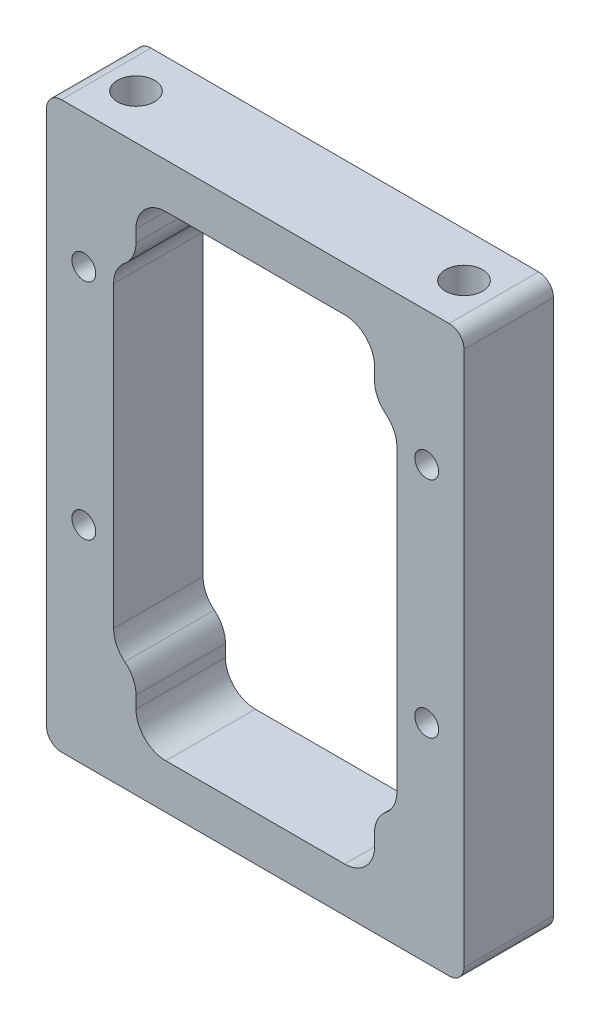
from build123d import *
from OCP.BRepFilletAPI import BRepFilletAPI_MakeFillet

# Parameters (mm, degrees)
SKETCH_1_W                  = 28
SKETCH_1_H                  = 37.9
EXTRUDE_1_DEPTH             = 3
HOLE_WIZARD_M3_1_AT_2_COUNT = 2
HOLE_WIZARD_M3_1_AT_2_PITCH = 22
HOLE_WIZARD_M2_1_D          = 1.6
SKETCH_8_W                  = 16
SKETCH_8_H                  = 31.9
CUT_EXTRUDE_1_DEPTH         = 18
SKETCH_9_W                  = 19
SKETCH_9_H                  = 23.9
CUT_EXTRUDE_2_DEPTH         = 18
FILLET_1_R                  = 2
FILLET_2_R1                 = 2
FILLET_2_R2                 = 1


with BuildPart() as part:
    # 草图1 → 凸台-拉伸1 (new, symmetric)
    with BuildSketch(Plane.XY):
        Rectangle(SKETCH_1_W, SKETCH_1_H)
    extrude(amount=EXTRUDE_1_DEPTH, both=True)

    # 草图4 → M3 螺纹孔1 (revolve, cut)
    with BuildSketch(Plane(origin=(-11, 18.95, 0), x_dir=(0, 0, 1), z_dir=(1, 0, 0))):
        Polygon((0, 0), (0, 7.251075774), (1.25, 6.5), (1.25, 0), align=None)
    hole_wizard_m3_1 = revolve(axis=Axis((-11, 25.3, 0), (0, -1, 0)), mode=Mode.SUBTRACT)

    # M3 螺纹孔1 at 2: M3 螺纹孔1 ×2
    with Locations(*[(i * HOLE_WIZARD_M3_1_AT_2_PITCH, 0, 0) for i in range(1, HOLE_WIZARD_M3_1_AT_2_COUNT)]):
        add(hole_wizard_m3_1, mode=Mode.SUBTRACT)

    # 镜向1: M3 螺纹孔1 across plane
    add(hole_wizard_m3_1.mirror(Plane.ZX), mode=Mode.SUBTRACT)

    # 镜向1 copy 1 sketch → 镜向1 copy 1 (revolve, cut)
    with BuildSketch(Plane(origin=(11, -18.95, 0), x_dir=(0, 0, 1), z_dir=(1, 0, 0))):
        Polygon((0, 0), (0, -7.251075774), (1.25, -6.5), (1.25, 0), align=None)
    revolve(axis=Axis((11, -25.3, 0), (0, -1, 0)), mode=Mode.SUBTRACT)

    # M2 螺纹孔1 (through all)
    with Locations(Plane(origin=(0, 0, -3), x_dir=(-1, 0, 0), z_dir=(0, 0, -1))):
        with Locations((-11.5, 10), (11.5, 10), (11.5, -5), (-11.5, -5)):
            Hole(HOLE_WIZARD_M2_1_D / 2)

    # 草图8 → 切除-拉伸1 (cut, symmetric)
    with BuildSketch(Plane(origin=(0, 0, -3), x_dir=(-1, 0, 0), z_dir=(0, 0, -1))):
        Rectangle(SKETCH_8_W, SKETCH_8_H)
    extrude(amount=CUT_EXTRUDE_1_DEPTH, both=True, mode=Mode.SUBTRACT)

    # 草图9 → 切除-拉伸2 (cut, symmetric)
    with BuildSketch(Plane(origin=(0, 0, -3), x_dir=(-1, 0, 0), z_dir=(0, 0, -1))):
        Rectangle(SKETCH_9_W, SKETCH_9_H)
    extrude(amount=CUT_EXTRUDE_2_DEPTH, both=True, mode=Mode.SUBTRACT)

    # 圆角1
    # the kernel refuses this fillet: 2 mm, written as the material it adds along each edge
    with BuildSketch(Plane(origin=(-9.5, 11.95, 3), x_dir=(1, 0, 0), z_dir=(0, 0, -1))) as fillet_1_piece_1:
        with BuildLine():
            CenterArc((2, 1.936491673), FILLET_1_R, 180, 75.522487814)
            Line((0, 1.936491673), (-0.04, 1.936491673))
            Line((-0.04, 1.936491673), (-0.04, 0))
            Line((-0.04, 0), (0, -0.04))
            ThreePointArc((0, -0.04), (0.75, -0.04), (1.49, -0.038729833))
            Line((1.49, -0.038729833), (1.5, 0))
        make_face()
    extrude(amount=6)
    with BuildSketch(Plane(origin=(-9.5, -11.95, 3), x_dir=(0, 1, 0), z_dir=(0, 0, -1))) as fillet_1_piece_2:
        with BuildLine():
            CenterArc((1.936491673, 2), FILLET_1_R, 194.477512186, 75.522487814)
            Line((0, 1.5), (-0.038729833, 1.49))
            ThreePointArc((-0.038729833, 1.49), (-0.04, 0.75), (-0.04, 0))
            Line((-0.04, 0), (0, -0.04))
            Line((0, -0.04), (1.936491673, -0.04))
            Line((1.936491673, -0.04), (1.936491673, 0))
        make_face()
    extrude(amount=6)
    with BuildSketch(Plane(origin=(9.5, -11.95, -3), x_dir=(-1, 0, 0), z_dir=(0, 0, 1))) as fillet_1_piece_3:
        with BuildLine():
            CenterArc((2, -1.936491673), FILLET_1_R, 104.477512186, 75.522487814)
            Line((0, -1.936491673), (-0.04, -1.936491673))
            Line((-0.04, -1.936491673), (-0.04, 0))
            Line((-0.04, 0), (0, 0.04))
            ThreePointArc((0, 0.04), (0.75, 0.04), (1.49, 0.038729833))
            Line((1.49, 0.038729833), (1.5, 0))
        make_face()
    extrude(amount=6)
    with BuildSketch(Plane(origin=(9.5, 11.95, -3), x_dir=(0, -1, 0), z_dir=(0, 0, 1))) as fillet_1_piece_4:
        with BuildLine():
            CenterArc((1.936491673, -2), FILLET_1_R, 90, 75.522487814)
            Line((0, -1.5), (-0.038729833, -1.49))
            ThreePointArc((-0.038729833, -1.49), (-0.04, -0.75), (-0.04, 0))
            Line((-0.04, 0), (0, 0.04))
            Line((0, 0.04), (1.936491673, 0.04))
            Line((1.936491673, 0.04), (1.936491673, 0))
        make_face()
    extrude(amount=6)

    # 圆角2: one fillet with a radius per group of edges: ONE call of the kernel's fillet builder (fillet() takes one radius for all edges)
    fillet_2_edges_1 = [part.edges().sort_by_distance(p)[0] for p in [
        (8, 11.95, 0),
        (8, 15.95, 0),
        (-8, -11.95, 0),
        (-8, 11.95, 0),
        (-8, 15.95, 0),
        (8, -11.95, 0),
        (8, -15.95, 0),
        (-8, -15.95, 0),
    ]]
    fillet_2_edges_2 = [part.edges().sort_by_distance(p)[0] for p in [
        (14, 18.95, 0),
        (-14, 18.95, 0),
        (-14, -18.95, 0),
        (14, -18.95, 0),
    ]]
    fillet_2 = BRepFilletAPI_MakeFillet(part.part.solid().wrapped)
    for e in fillet_2_edges_1:
        fillet_2.Add(FILLET_2_R1, e.wrapped)
    for e in fillet_2_edges_2:
        fillet_2.Add(FILLET_2_R2, e.wrapped)
    add(Compound.cast(fillet_2.Shape()), mode=Mode.REPLACE)


solid = part.part
